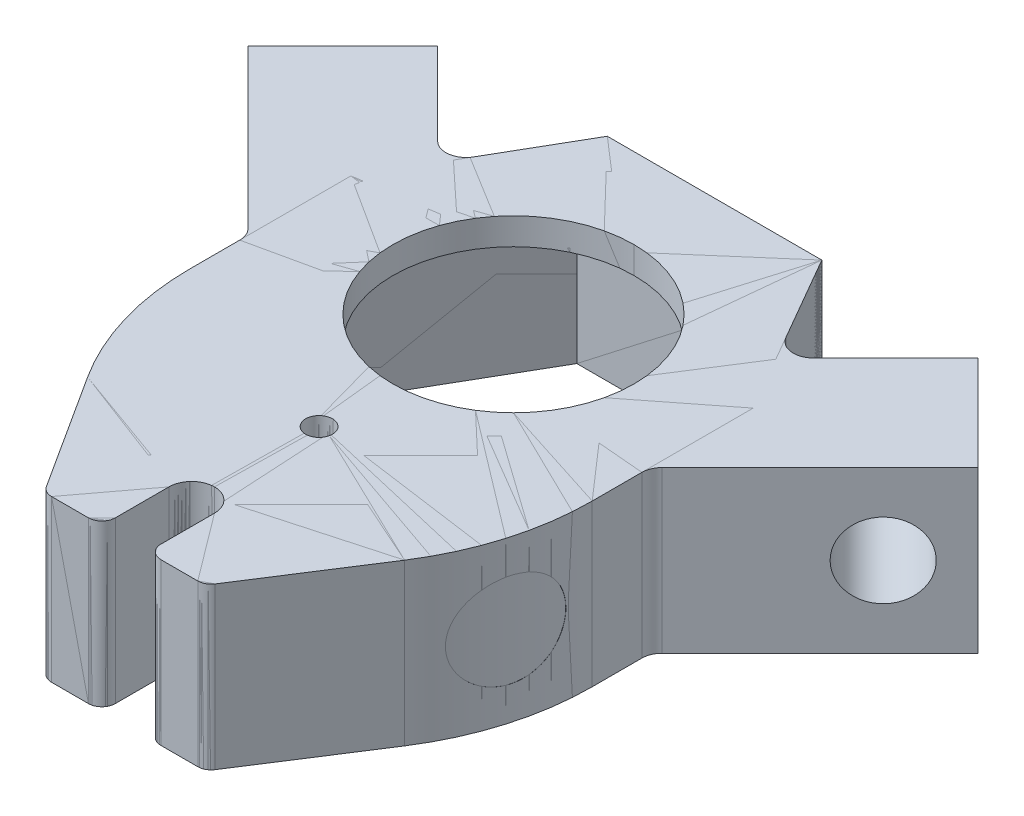
from build123d import *

# Parameters (mm, degrees)
SKETCH1_W           = 30
SKETCH1_H           = 30
BOSS_EXTRUDE1_DEPTH = 12
BOSS_EXTRUDE6_DEPTH = 12
CHAMFER1_SIZE       = 7
CHAMFER1_SIZE2      = 12.124355653
BOSS_EXTRUDE4_DEPTH = 12
SKETCH7_R           = 2.8
CUT_EXTRUDE2_DEPTH  = 15
CHAMFER2_SIZE       = 9
CHAMFER2_SIZE_2     = 14
CHAMFER3_SIZE       = 14
CHAMFER3_SIZE_2     = 9
FILLET2_R           = 20
FILLET3_R           = 1
FILLET4_R           = 1.5
SKETCH10_R          = 1
CUT_EXTRUDE3_DEPTH  = 42.546660516
SKETCH11_R          = 2
CUT_EXTRUDE4_DEPTH  = 42.546660516
SKETCH12_R          = 9
BOSS_EXTRUDE8_DEPTH = 2
SKETCH13_R          = 3.5
CUT_EXTRUDE5_DEPTH  = 8


with BuildPart() as part:
    # Sketch1 → Boss-Extrude1 (new body)
    with BuildSketch(Plane(origin=(0, 0, 0), x_dir=(1, 0, 0), z_dir=(0, 1, 0))):
        Rectangle(SKETCH1_W, SKETCH1_H)
        Polygon((6.452466608, -11.176), (12.904933217, 0), (6.452466608, 11.176), (-6.452466608, 11.176), (-12.904933217, 0), (-6.452466608, -11.176), align=None, mode=Mode.SUBTRACT)
    extrude(amount=BOSS_EXTRUDE1_DEPTH)

    # Sketch8 → Boss-Extrude6 (add)
    with BuildSketch(Plane(origin=(0, 0, 0), x_dir=(1, 0, 0), z_dir=(0, 1, 0))):
        with BuildLine():
            Line((-6, -15), (6, -15))
            Line((6, -15), (6, -29))
            Line((6, -29), (1.7, -29))
            Line((1.7, -29), (1.7, -24))
            ThreePointArc((1.7, -24), (0, -22.3), (-1.7, -24))
            Line((-1.7, -24), (-1.7, -29))
            Line((-1.7, -29), (-6, -29))
            Line((-6, -29), (-6, -15))
        make_face()
    extrude(amount=BOSS_EXTRUDE6_DEPTH)

    # Chamfer1
    chamfer1_edges = [part.edges().sort_by_distance(p)[0] for p in [
        (-15, 6, -15),
        (15, 6, -15),
    ]]
    chamfer1_side = [part.faces().sort_by_distance(p)[0] for p in [
        (0, 6, -15),
    ]]
    chamfer(chamfer1_edges, length=CHAMFER1_SIZE, length2=CHAMFER1_SIZE2, reference=chamfer1_side[0])

    # Sketch6 → Boss-Extrude4 (add)
    with BuildSketch(Plane(origin=(0, 0, 0), x_dir=(1, 0, 0), z_dir=(0, 1, 0))):
        Polygon((-27.223611076, 7.424621202), (-15, -4.798989873), (-15, 2.875644347), (-12.632730187, 6.975875938), (-20.152543264, 14.495689014), align=None)
    extrude(amount=BOSS_EXTRUDE4_DEPTH)

    # Sketch7 → Cut-Extrude2 (cut)
    with BuildSketch(Plane(origin=(-9.899494937, 0, 9.899494937), x_dir=(0.7071067811865438, 0, 0.7071067811865512), z_dir=(-0.7071067811865512, 0, 0.7071067811865438))):
        with Locations((-19.5, 6)):
            Circle(SKETCH7_R)
    extrude(amount=-CUT_EXTRUDE2_DEPTH, mode=Mode.SUBTRACT)

    # Chamfer2
    # the kernel refuses this chamfer: 14, 9 mm, written as the material it adds along each edge
    with BuildSketch(Plane(origin=(6, 0, 15), x_dir=(0.9987204462012896, 0, -0.05057143798130468), z_dir=(0, 1, 0))) as chamfer2_piece_1:
        Polygon((CHAMFER2_SIZE * 0.998720446201, -CHAMFER2_SIZE * 0.0505714379813), (-CHAMFER2_SIZE_2 * 0.0505714379813, -CHAMFER2_SIZE_2 * 0.998720446201), (0, 0), align=None)
    extrude(amount=12)

    # Chamfer3
    # the kernel refuses this chamfer: 14, 9 mm, written as the material it adds along each edge
    with BuildSketch(Plane(origin=(-6, 0, 15), x_dir=(0.020921616646829202, 0, 0.9997811190240007), z_dir=(0, 1, 0))) as chamfer3_piece_1:
        Polygon((CHAMFER3_SIZE * 0.999781119024, -CHAMFER3_SIZE * 0.0209216166468), (-CHAMFER3_SIZE_2 * 0.0209216166468, -CHAMFER3_SIZE_2 * 0.999781119024), (0, 0), align=None)
    extrude(amount=12)

    # Fillet2
    fillet2_edges = [part.edges().sort_by_distance(p)[0] for p in [
        (15, 6, 15),
        (-15, 6, 15),
    ]]
    fillet(fillet2_edges, radius=FILLET2_R)

    # Fillet3
    fillet3_edges = [part.edges().sort_by_distance(p)[0] for p in [
        (-6, 6, 29),
        (-1.7, 6, 29),
        (1.7, 6, 29),
        (6, 6, 29),
    ]]
    fillet(fillet3_edges, radius=FILLET3_R)

    # Fillet4
    fillet4_edges = [part.edges().sort_by_distance(p)[0] for p in [
        (-15, 6, 4.798989873),
        (-12.632730187, 6, -6.975875938),
    ]]
    fillet(fillet4_edges, radius=FILLET4_R)

    # Sketch10 → Cut-Extrude3 (cut, through all)
    with BuildSketch(Plane(origin=(0, 12, 0), x_dir=(1, 0, 0), z_dir=(0, 1, 0))):
        with Locations(Location((0, -14.5, 0), (0, 0, 270))):
            Circle(SKETCH10_R)
    extrude(amount=-CUT_EXTRUDE3_DEPTH, mode=Mode.SUBTRACT)

    # Sketch11 → Cut-Extrude4 (cut, through all)
    with BuildSketch(Plane(origin=(0, 0, 0), x_dir=(0, 0, -1), z_dir=(1, 0, 0))):
        with Locations(Location((-14.5, 6, 0), (0, 0, 180))):
            Circle(SKETCH11_R)
    extrude(amount=CUT_EXTRUDE4_DEPTH, mode=Mode.SUBTRACT)

    # Sketch12 → Boss-Extrude8 (add)
    with BuildSketch(Plane(origin=(0, 12, 0), x_dir=(1, 0, 0), z_dir=(0, 1, 0))):
        Polygon((6.452466608, 11.176), (-6.452466608, 11.176), (-12.904933217, 0), (-6.452466608, -11.176), (6.452466608, -11.176), (12.904933217, 0), align=None)
        with Locations(Location((0, 0, 0), (0, 0, 270))):
            Circle(SKETCH12_R, mode=Mode.SUBTRACT)
    extrude(amount=-BOSS_EXTRUDE8_DEPTH)

    # Sketch13 → Cut-Extrude5 (cut)
    with BuildSketch(Plane(origin=(15, 0, 0), x_dir=(0, 0, -1), z_dir=(1, 0, 0))):
        with Locations((-14.5, 6)):
            Circle(SKETCH13_R)
    extrude(amount=-CUT_EXTRUDE5_DEPTH, mode=Mode.SUBTRACT)


with BuildPart() as body_2:
    # Mirror2: mirrored copy
    add(part.part.mirror(Plane(origin=(0, 0, 0), x_dir=(0, 0, 1), z_dir=(1, 0, 0))))


solid = Compound([part.part, body_2.part])
